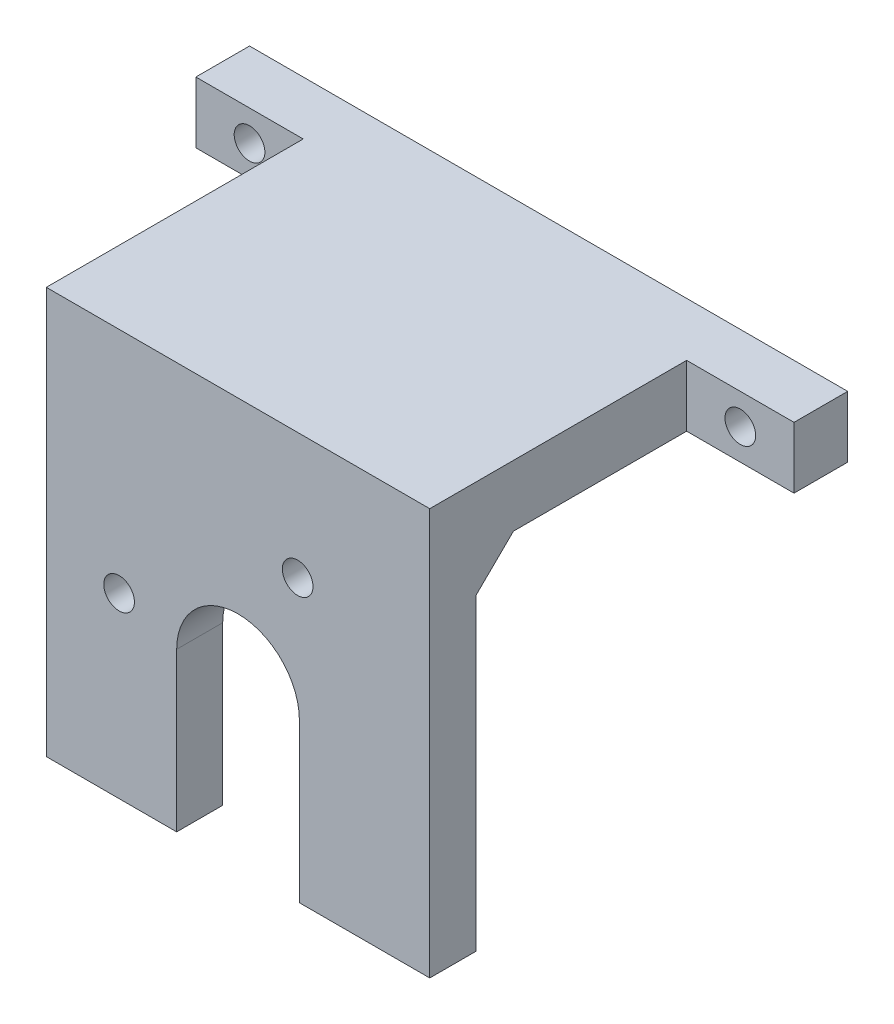
from build123d import *

# Parameters (mm, degrees)
SKETCH1_W           = 50
SKETCH1_H           = 18
BOSS_EXTRUDE1_DEPTH = 7
SKETCH2_W           = 50
SKETCH2_H           = 8
BOSS_EXTRUDE2_DEPTH = 33.5
SKETCH3_W           = 7
SKETCH3_H           = 8
BOSS_EXTRUDE3_DEPTH = 14
SKETCH4_W           = 7
SKETCH4_H           = 8
BOSS_EXTRUDE4_DEPTH = 14
SKETCH5_W           = 50
SKETCH5_H           = 10
CUT_EXTRUDE1_DEPTH  = 14
SKETCH6_R           = 2
CUT_EXTRUDE2_DEPTH  = 14
SKETCH7_W           = 50
SKETCH7_H           = 6
BOSS_EXTRUDE5_DEPTH = 45
CUT_EXTRUDE3_DEPTH  = 35
SKETCH9_R           = 2
CUT_EXTRUDE5_DEPTH  = 35
BOSS_EXTRUDE8_DEPTH = 50


with BuildPart() as part:
    # Sketch1 → Boss-Extrude1 (new body)
    with BuildSketch(Plane.XY):
        with Locations((-12.394067797, 1.955508475)):
            Rectangle(SKETCH1_W, SKETCH1_H)
    extrude(amount=BOSS_EXTRUDE1_DEPTH)

    # Sketch2 → Boss-Extrude2 (add)
    with BuildSketch(Plane.XY.offset(7)):
        with Locations((-12.394067797, 6.955508475)):
            Rectangle(SKETCH2_W, SKETCH2_H)
    extrude(amount=BOSS_EXTRUDE2_DEPTH)

    # Sketch3 → Boss-Extrude3 (add)
    with BuildSketch(Plane(origin=(12.605932203, 0, 0), x_dir=(0, 0, -1), z_dir=(1, 0, 0))):
        with Locations((-3.5, 6.955508475)):
            Rectangle(SKETCH3_W, SKETCH3_H)
    extrude(amount=BOSS_EXTRUDE3_DEPTH)

    # Sketch4 → Boss-Extrude4 (add)
    with BuildSketch(Plane.ZY.offset(37.394067797)):
        with Locations((3.5, 6.955508475)):
            Rectangle(SKETCH4_W, SKETCH4_H)
    extrude(amount=BOSS_EXTRUDE4_DEPTH)

    # Sketch5 → Cut-Extrude1 (cut)
    with BuildSketch(Plane.XY.offset(7)):
        with Locations((-12.394067797, -2.044491525)):
            Rectangle(SKETCH5_W, SKETCH5_H)
    extrude(amount=-CUT_EXTRUDE1_DEPTH, mode=Mode.SUBTRACT)

    # Sketch6 → Cut-Extrude2 (cut)
    with BuildSketch(Plane.XY.offset(7)):
        with Locations((-44.394067797, 6.955508475)):
            Circle(SKETCH6_R)
        with Locations((19.605932203, 6.955508475)):
            Circle(SKETCH6_R)
    extrude(amount=-CUT_EXTRUDE2_DEPTH, mode=Mode.SUBTRACT)

    # Sketch7 → Boss-Extrude5 (add)
    with BuildSketch(Plane.XZ.offset(-2.955508475)):
        with Locations((-12.394067797, 37.5)):
            Rectangle(SKETCH7_W, SKETCH7_H)
    extrude(amount=BOSS_EXTRUDE5_DEPTH)

    # Sketch8 → Cut-Extrude3 (cut)
    with BuildSketch(Plane.XY.offset(40.5)):
        with BuildLine():
            Line((-4.394067797, -21.42115583), (-4.394067797, -42.044491525))
            ThreePointArc((-4.394067797, -42.044491525), (-12.394067797, -50.044491525), (-20.394067797, -42.044491525))
            Line((-20.394067797, -42.044491525), (-20.394067797, -21.42115583))
            ThreePointArc((-20.394067797, -21.42115583), (-12.394067797, -13.42115583), (-4.394067797, -21.42115583))
        make_face()
    extrude(amount=-CUT_EXTRUDE3_DEPTH, mode=Mode.SUBTRACT)

    # Sketch9 → Cut-Extrude5 (cut)
    with BuildSketch(Plane(origin=(0, 0, 34.5), x_dir=(-1, 0, 0), z_dir=(0, 0, -1))):
        with Locations((27.901028765, -18.846933891)):
            Circle(SKETCH9_R)
        with Locations((4.616687569, -5.460715783)):
            Circle(SKETCH9_R)
    extrude(amount=-CUT_EXTRUDE5_DEPTH, mode=Mode.SUBTRACT)

    # Sketch12 → Boss-Extrude8 (add)
    with BuildSketch(Plane.ZY.offset(37.394067797)):
        Polygon((34.5, -1.873493289), (29.5872605, 2.955508475), (34.5, 2.955508475), align=None)
    extrude(amount=-BOSS_EXTRUDE8_DEPTH)


solid = part.part
